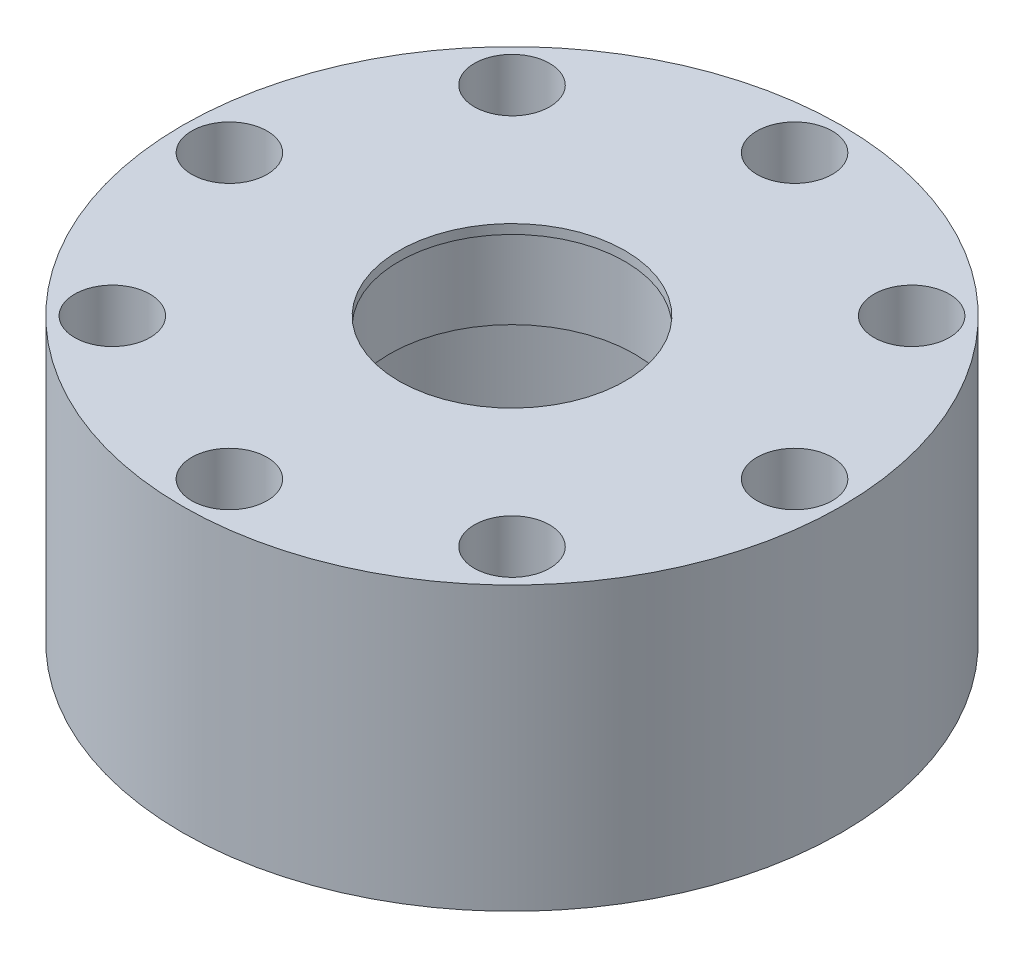
from build123d import *

# Parameters (mm, degrees)
SKETCH2_R          = 2
CUT_EXTRUDE1_DEPTH = 29.939592257


with BuildPart() as part:
    # Sketch1 → Revolve1 (revolve)
    with BuildSketch(Plane.XY):
        Polygon((12.5, 0), (17.5, 0), (17.5, 15), (6, 15), (6, 14.5), (6.5, 14.5), (6.5, 10), (7.5, 10), (7.5, 12), (10, 12), (10, 10), (12.5, 10), align=None)
    revolve(axis=Axis((0, 0, 0), (0, 1, 0)))

    # Sketch2 → Cut-Extrude1 (cut, through all)
    with BuildSketch(Plane(origin=(0, 15, 0), x_dir=(1, 0, 0), z_dir=(0, 1, 0))):
        with Locations((15, 0)):
            Circle(SKETCH2_R)
        with Locations((10.606601718, -10.606601718)):
            Circle(SKETCH2_R)
        with Locations((0, -15)):
            Circle(SKETCH2_R)
        with Locations((-10.606601718, -10.606601718)):
            Circle(SKETCH2_R)
        with Locations((-15, 0)):
            Circle(SKETCH2_R)
        with Locations((-10.606601718, 10.606601718)):
            Circle(SKETCH2_R)
        with Locations((0, 15)):
            Circle(SKETCH2_R)
        with Locations((10.606601718, 10.606601718)):
            Circle(SKETCH2_R)
    extrude(amount=-CUT_EXTRUDE1_DEPTH, mode=Mode.SUBTRACT)


solid = part.part
